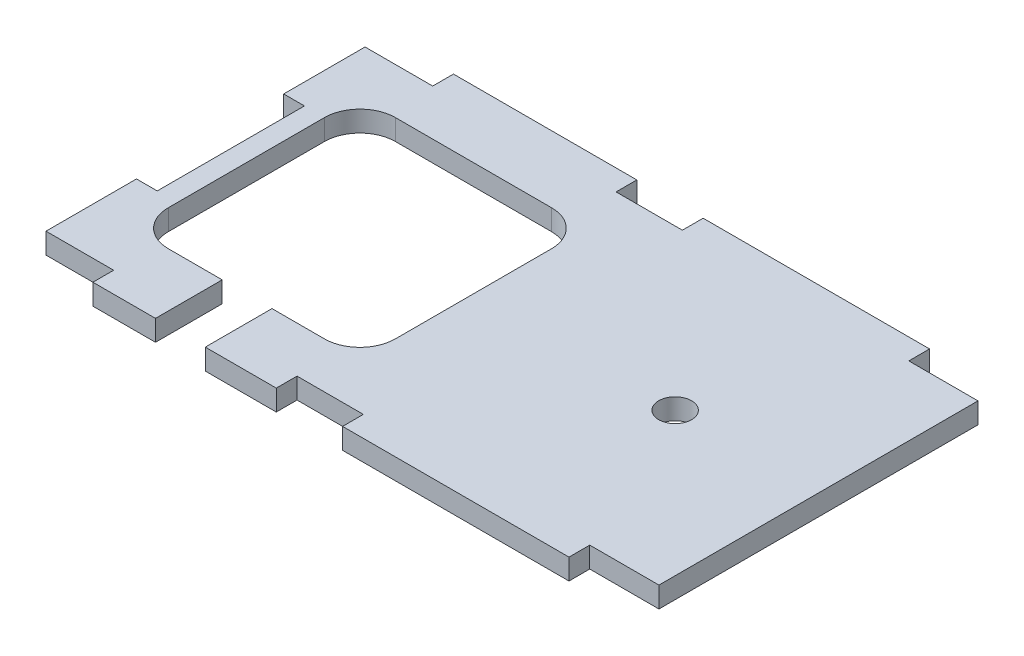
from build123d import *

# Parameters (mm, degrees)
SKETCH1_W             = 172.72
SKETCH1_H             = 101.6
BOSS_EXTRUDE1_DEPTH   = 5.85
SKETCH5_R             = 4.635
CUT_EXTRUDE10_DEPTH   = 20
FILLET6_R             = 10
CAVITY1_START         = -50.8
CAVITY1_OUTLINE_W     = 19.066688648
CAVITY1_OUTLINE_H     = 5.85
CAVITY1_OUTLINE_W_2   = 18.685550926
CAVITY1_OUTLINE_W_3   = 19.50170991
CAVITY1_DEPTH         = 5.85
CAVITY1_START_2       = 44.95
CAVITY1_2_OUTLINE_W   = 19.066688648
CAVITY1_2_OUTLINE_H   = 5.85
CAVITY1_2_OUTLINE_W_2 = 18.685550926
CAVITY1_2_OUTLINE_W_3 = 19.50170991
CAVITY1_2_DEPTH       = 5.85
CAVITY1_START_3       = -22.02311963
CAVITY1_3_OUTLINE_W   = 5.85
CAVITY1_3_OUTLINE_H   = 5.85
CAVITY1_3_DEPTH       = 41.475447085


# Read off the part's stored shape, not the designer's step: Cavity1
with BuildPart() as part:
    # Sketch1 → Boss-Extrude1 (new body)
    with BuildSketch(Plane(origin=(0, 0, 0), x_dir=(1, 0, 0), z_dir=(0, 1, 0))):
        Rectangle(SKETCH1_W, SKETCH1_H)
    extrude(amount=BOSS_EXTRUDE1_DEPTH)

    # Sketch5 → Cut-Extrude10 (cut)
    with BuildSketch(Plane(origin=(0, 0, 0), x_dir=(1, 0, 0), z_dir=(0, 1, 0))):
        with Locations(Location((45.9739194, 0, 0), (0, 0, 90))):
            Circle(SKETCH5_R)
        Polygon((-10.850825335, 32), (-10.850825335, 0), (-10.850825335, -32), (-35.627924906, -32), (-35.627924906, -50.8), (-49.659575094, -50.8), (-49.659575094, -32), (-74.850825335, -32), (-74.850825335, 32), (-42.850825335, 32), align=None)
    extrude(amount=CUT_EXTRUDE10_DEPTH, mode=Mode.SUBTRACT)

    # Fillet6
    fillet6_edges = [part.edges().sort_by_distance(p)[0] for p in [
        (-10.850825335, 2.925, -32),
        (-74.850825335, 2.925, -32),
        (-74.850825335, 2.925, 32),
        (-10.850825335, 2.925, 32),
    ]]
    fillet(fillet6_edges, radius=FILLET6_R)

    # Cavity1 outline → Cavity1 (cut)
    with BuildSketch(Plane.XY.offset(CAVITY1_START)):
        with Locations((-76.826655676, 2.925)):
            Rectangle(CAVITY1_OUTLINE_W, CAVITY1_OUTLINE_H)
        with Locations((-6.281963463, 2.925)):
            Rectangle(CAVITY1_OUTLINE_W_2, CAVITY1_OUTLINE_H)
        with Locations((76.609145045, 2.925)):
            Rectangle(CAVITY1_OUTLINE_W_3, CAVITY1_OUTLINE_H)
    extrude(amount=CAVITY1_DEPTH, mode=Mode.SUBTRACT)

    # Cavity1 2 outline → Cavity1 2 (cut)
    with BuildSketch(Plane.XY.offset(CAVITY1_START_2)):
        with Locations((-76.826655676, 2.925)):
            Rectangle(CAVITY1_2_OUTLINE_W, CAVITY1_2_OUTLINE_H)
        with Locations((-6.281963463, 2.925)):
            Rectangle(CAVITY1_2_OUTLINE_W_2, CAVITY1_2_OUTLINE_H)
        with Locations((76.609145045, 2.925)):
            Rectangle(CAVITY1_2_OUTLINE_W_3, CAVITY1_2_OUTLINE_H)
    extrude(amount=CAVITY1_2_DEPTH, mode=Mode.SUBTRACT)

    # Cavity1 3 outline → Cavity1 3 (cut)
    with BuildSketch(Plane.XY.offset(CAVITY1_START_3)):
        with Locations((-83.435, 2.925)):
            Rectangle(CAVITY1_3_OUTLINE_W, CAVITY1_3_OUTLINE_H)
    extrude(amount=CAVITY1_3_DEPTH, mode=Mode.SUBTRACT)


solid = part.part
